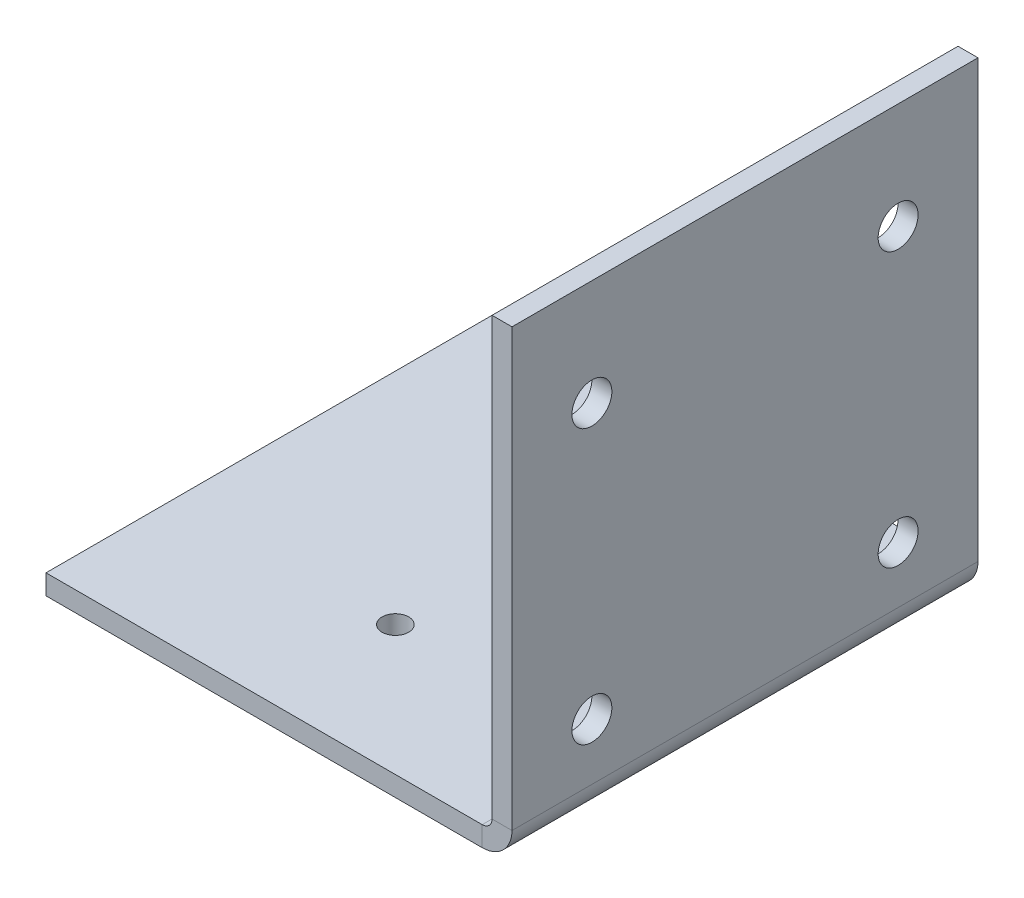
from build123d import *

# Parameters (mm, degrees)
SKETCH1_W                    = 35
SKETCH1_H                    = 35
BASE_FLANGE1_DEPTH           = 1.5
EDGE_FLANGE1_STRIP_W         = 7.4732
EDGE_FLANGE1_STRIP_H         = 1.5
EDGE_FLANGE1_STRIP_CUT_DEPTH = 35
EDGE_FLANGE1_DEPTH           = 35
CUT_EXTRUDE1_REACH           = 62.39
SKETCH9_R                    = 1.5
CUT_EXTRUDE2_REACH           = 122.529
SKETCH10_R                   = 1


# Sheet-metal steps are written as plain solids
with BuildPart() as part:
    # Sketch1 → Base-Flange1 (new body)
    with BuildSketch(Plane(origin=(0, 12.100921456, 0), x_dir=(1, 0, 0), z_dir=(0, 1, 0))):
        with Locations((-96.5, 0)):
            Rectangle(SKETCH1_W, SKETCH1_H)
    extrude(amount=BASE_FLANGE1_DEPTH)

    # Edge-Flange1 strip (across the edge) → Edge-Flange1 strip cut (cut)
    with BuildSketch(Plane(origin=(-79, 13.600921456, 17.5), x_dir=(-1, 0, 0), z_dir=(0, 0, -1))):
        with Locations((-1.5, -0.75)):
            Rectangle(EDGE_FLANGE1_STRIP_W, EDGE_FLANGE1_STRIP_H)
    extrude(amount=EDGE_FLANGE1_STRIP_CUT_DEPTH, mode=Mode.SUBTRACT)

    # Edge-Flange1 section (across the edge) → Edge-Flange1 (add)
    with BuildSketch(Plane(origin=(-79, 13.600921456, 17.5), x_dir=(-1, 0, 0), z_dir=(0, 0, -1))):
        with BuildLine():
            Line((0, 0.7366), (0, 33.5))
            Line((0, 33.5), (1.5, 33.5))
            Line((1.5, 33.5), (1.5, 0.7366))
            ThreePointArc((1.5, 0.7366), (1.715745145, 0.215745145), (2.2366, 0))
            Line((2.2366, 0), (2.2366, -1.5))
            ThreePointArc((2.2366, -1.5), (0.655084973, -0.844915027), (0, 0.7366))
        make_face()
    extrude(amount=EDGE_FLANGE1_DEPTH)

    # Sketch9 → Cut-Extrude1 (cut, up to next)
    with BuildSketch(Plane.ZY.offset(80.5), mode=Mode.PRIVATE) as cut_extrude1_sk1:
        with Locations(Location((-11.5, 39.145, 0), (0, 0, 270))):
            Circle(SKETCH9_R)
    cut_extrude1_tool1 = extrude(cut_extrude1_sk1.sketch, amount=-CUT_EXTRUDE1_REACH, mode=Mode.PRIVATE) & part.part
    # Sketch9 → Cut-Extrude1 (cut, up to next)
    with BuildSketch(Plane.ZY.offset(80.5), mode=Mode.PRIVATE) as cut_extrude1_sk2:
        with Locations(Location((11.5, 39.145, 0), (0, 0, 270))):
            Circle(SKETCH9_R)
    cut_extrude1_tool2 = extrude(cut_extrude1_sk2.sketch, amount=-CUT_EXTRUDE1_REACH, mode=Mode.PRIVATE) & part.part
    # Sketch9 → Cut-Extrude1 (cut, up to next)
    with BuildSketch(Plane.ZY.offset(80.5), mode=Mode.PRIVATE) as cut_extrude1_sk3:
        with Locations(Location((11.5, 18.578902177, 0), (0, 0, 270))):
            Circle(SKETCH9_R)
    cut_extrude1_tool3 = extrude(cut_extrude1_sk3.sketch, amount=-CUT_EXTRUDE1_REACH, mode=Mode.PRIVATE) & part.part
    # Sketch9 → Cut-Extrude1 (cut, up to next)
    with BuildSketch(Plane.ZY.offset(80.5), mode=Mode.PRIVATE) as cut_extrude1_sk4:
        with Locations(Location((-11.5, 18.578902177, 0), (0, 0, 270))):
            Circle(SKETCH9_R)
    cut_extrude1_tool4 = extrude(cut_extrude1_sk4.sketch, amount=-CUT_EXTRUDE1_REACH, mode=Mode.PRIVATE) & part.part
    add(cut_extrude1_tool1.solids().sort_by_distance((-80.5, 39.145, -11.5))[0], mode=Mode.SUBTRACT)
    add(cut_extrude1_tool2.solids().sort_by_distance((-80.5, 39.145, 11.5))[0], mode=Mode.SUBTRACT)
    add(cut_extrude1_tool3.solids().sort_by_distance((-80.5, 18.578902, 11.5))[0], mode=Mode.SUBTRACT)
    add(cut_extrude1_tool4.solids().sort_by_distance((-80.5, 18.578902, -11.5))[0], mode=Mode.SUBTRACT)

    # Sketch10 → Cut-Extrude2 (cut, up to next)
    with BuildSketch(Plane.XZ.offset(-12.100921456), mode=Mode.PRIVATE) as cut_extrude2_sk1:
        with Locations(Location((-97.512607475, -7.747, 0), (0, 0, 270))):
            Circle(SKETCH10_R)
    cut_extrude2_tool1 = extrude(cut_extrude2_sk1.sketch, amount=-CUT_EXTRUDE2_REACH, mode=Mode.PRIVATE) & part.part
    # Sketch10 → Cut-Extrude2 (cut, up to next)
    with BuildSketch(Plane.XZ.offset(-12.100921456), mode=Mode.PRIVATE) as cut_extrude2_sk2:
        with Locations(Location((-97.512607475, 7.747, 0), (0, 0, 270))):
            Circle(SKETCH10_R)
    cut_extrude2_tool2 = extrude(cut_extrude2_sk2.sketch, amount=-CUT_EXTRUDE2_REACH, mode=Mode.PRIVATE) & part.part
    add(cut_extrude2_tool1.solids().sort_by_distance((-97.512607, 12.100921, -7.747))[0], mode=Mode.SUBTRACT)
    add(cut_extrude2_tool2.solids().sort_by_distance((-97.512607, 12.100921, 7.747))[0], mode=Mode.SUBTRACT)


solid = part.part
